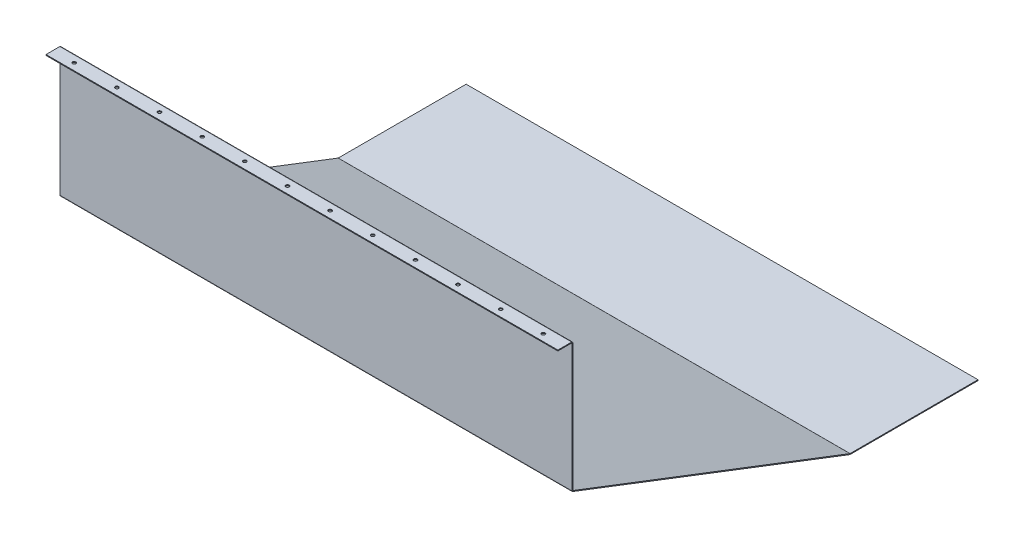
from build123d import *

# Parameters (mm, degrees)
BASE_FLANGE1_DEPTH = 600
EDGE_FLANGE1_DEPTH = 1200
SKETCH7_R          = 4
CUT_EXTRUDE1_DEPTH = 10


# Sheet-metal steps are written as plain solids
with BuildPart() as part:
    # Sketch1 → Base-Flange1 (new, symmetric)
    with BuildSketch(Plane(origin=(0, 0, 0), x_dir=(0, 0, -1), z_dir=(1, 0, 0))):
        with BuildLine():
            Line((0, 0), (0, -299.494103784))
            ThreePointArc((0, -299.494103784), (0.129412109, -299.911119881), (0.47217601, -300.181606158))
            Line((0.47217601, -300.181606158), (649.872346171, -549.950902374))
            ThreePointArc((649.872346171, -549.950902374), (650.002298395, -549.987621585), (650.136770161, -550))
            Line((650.136770161, -550), (950, -550))
            Line((950, -550), (950, -552))
            Line((950, -552), (650.136717071, -552))
            ThreePointArc((650.136717071, -552), (649.637152182, -551.954006147), (649.154377846, -551.817589676))
            Line((649.154377846, -551.817589676), (-0.245782148, -302.04829737))
            ThreePointArc((-0.245782148, -302.04829737), (-1.519211001, -301.043392746), (-2, -299.494103784))
            Line((-2, -299.494103784), (-2, 0))
            Line((-2, 0), (0, 0))
        make_face()
    extrude(amount=BASE_FLANGE1_DEPTH, both=True)

    # Edge-Flange1 section (across the edge) → Edge-Flange1 (add)
    with BuildSketch(Plane(origin=(600, 0.7366, 2), x_dir=(0, -1, 0), z_dir=(-1, 0, 0))):
        with BuildLine():
            Line((-2, 0.7366), (-2, 33))
            Line((-2, 33), (0, 33))
            Line((0, 33), (0, 0.7366))
            ThreePointArc((0, 0.7366), (0.215745145, 0.215745145), (0.7366, 0))
            Line((0.7366, 0), (0.7366, -2))
            ThreePointArc((0.7366, -2), (-1.198468417, -1.198468417), (-2, 0.7366))
        make_face()
    extrude(amount=EDGE_FLANGE1_DEPTH)

    # Sketch7 → Cut-Extrude1 (cut)
    with BuildSketch(Plane.XZ.offset(-0.7366)):
        with Locations(Location((-550, 18.8683, 0), (0, 0, 270))):
            Circle(SKETCH7_R)
        with Locations(Location((-450, 18.8683, 0), (0, 0, 270))):
            Circle(SKETCH7_R)
        with Locations(Location((-350, 18.8683, 0), (0, 0, 270))):
            Circle(SKETCH7_R)
        with Locations(Location((-250, 18.8683, 0), (0, 0, 270))):
            Circle(SKETCH7_R)
        with Locations(Location((-150, 18.8683, 0), (0, 0, 270))):
            Circle(SKETCH7_R)
        with Locations(Location((-50, 18.8683, 0), (0, 0, 270))):
            Circle(SKETCH7_R)
        with Locations(Location((50, 18.8683, 0), (0, 0, 270))):
            Circle(SKETCH7_R)
        with Locations(Location((150, 18.8683, 0), (0, 0, 270))):
            Circle(SKETCH7_R)
        with Locations(Location((250, 18.8683, 0), (0, 0, 270))):
            Circle(SKETCH7_R)
        with Locations(Location((350, 18.8683, 0), (0, 0, 270))):
            Circle(SKETCH7_R)
        with Locations(Location((450, 18.8683, 0), (0, 0, 270))):
            Circle(SKETCH7_R)
        with Locations(Location((550, 18.8683, 0), (0, 0, 270))):
            Circle(SKETCH7_R)
    extrude(amount=-CUT_EXTRUDE1_DEPTH, mode=Mode.SUBTRACT)


solid = part.part
